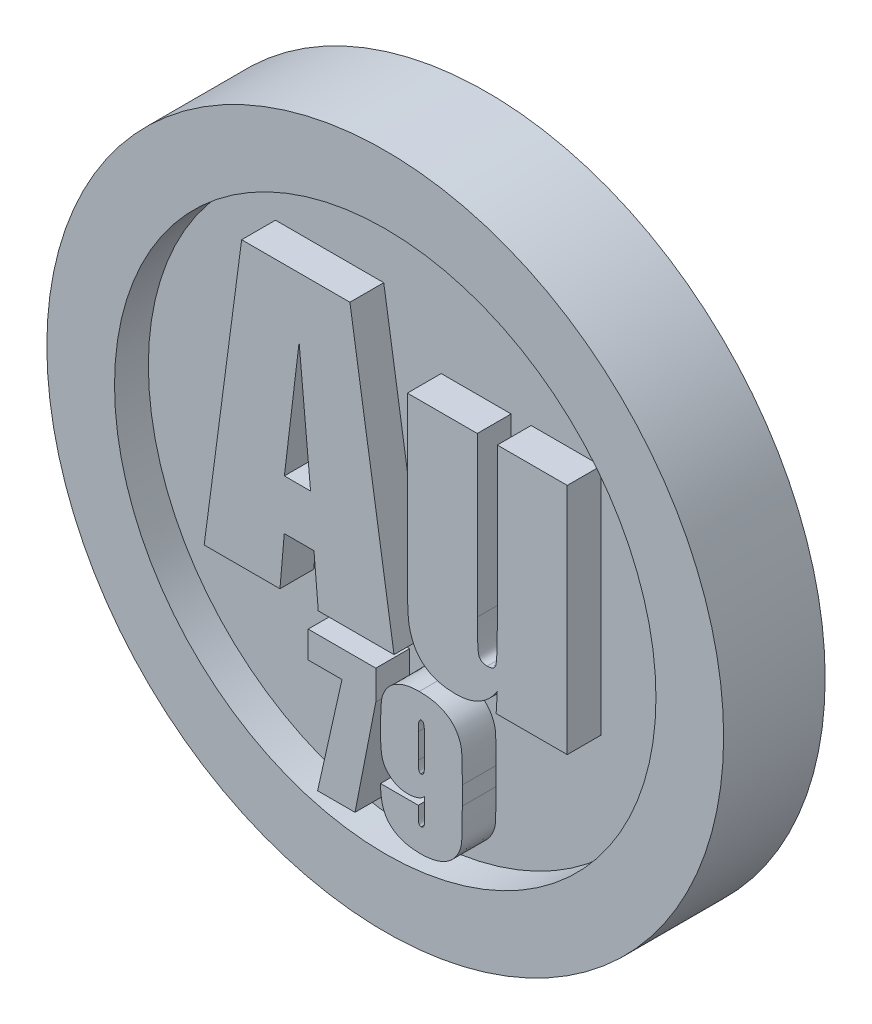
from build123d import *

# Parameters (mm, degrees)
SKETCH_1_R          = 10
EXTRUDE_1_DEPTH     = 3
SKETCH_2_R          = 8
CUT_EXTRUDE_1_DEPTH = 1
EXTRUDE_3_DEPTH     = 1


# Read off the part's stored shape, not the designer's step: 凸台-拉伸3
with BuildPart() as part:
    # 草图1 → 凸台-拉伸1 (new body)
    with BuildSketch(Plane.XY):
        Circle(SKETCH_1_R)
    extrude(amount=EXTRUDE_1_DEPTH)

    # 草图2 → 切除-拉伸1 (cut)
    with BuildSketch(Plane.XY.offset(3)):
        Circle(SKETCH_2_R)
    extrude(amount=-CUT_EXTRUDE_1_DEPTH, mode=Mode.SUBTRACT)

    # 凸台-拉伸3 outline → 凸台-拉伸3 (add)
    # profile 1 of 4: a face of its own
    with BuildSketch(Plane.XY.offset(2)):
        with BuildLine():
            add(Edge.make_bspline(
                [(3.012789225, -1.687269702), (3.045348533, -1.686038209), (3.104946538, -1.683784029), (3.185224789, -1.654478221), (3.243607919, -1.602430732), (3.270375839, -1.539755165), (3.279792433, -1.474668249), (3.290192494, -1.40305599), (3.294308978, -1.309431072), (3.301318612, -1.194689415), (3.305562089, -1.058271151), (3.308006769, -0.900357085), (3.31209312, -0.720432098), (3.311476185, -0.593281641), (3.311150326, -0.526122117)],
                knots=[0, 0, 0, 0, 0.073005663, 0.133632809, 0.188340706, 0.244096719, 0.282789643, 0.336304753, 0.406825489, 0.493468461, 0.595044245, 0.713887454, 0.848878385, 1, 1, 1, 1], degree=3))
            add(Edge.make_bspline(
                [(2.720579899, -0.578412206), (2.720248015, -0.642496334), (2.719621371, -0.763496405), (2.723758231, -0.934701432), (2.726078574, -1.084939222), (2.730686012, -1.21465864), (2.736556105, -1.323908084), (2.743982945, -1.41316638), (2.752466945, -1.482140019), (2.765425852, -1.544887938), (2.792375012, -1.604945294), (2.850110239, -1.653777043), (2.925532864, -1.683712524), (2.982224769, -1.686023681), (3.012789225, -1.687269702)],
                knots=[0, 0, 0, 0, 0.151003576, 0.285116516, 0.403527971, 0.505067069, 0.590973108, 0.661298637, 0.716141007, 0.754532757, 0.812341691, 0.867117496, 0.928358709, 1, 1, 1, 1], degree=3))
            Line((2.720579899, -0.578412206), (2.720579899, 4.120006168))
            Line((2.720579899, 4.120006168), (0.653583403, 4.120006168))
            Line((0.653583403, 4.120006168), (0.653583403, -0.509204734))
            add(Edge.make_bspline(
                [(2.076181438, -2.868410556), (2.00274373, -2.866446507), (1.861839797, -2.862678111), (1.660148026, -2.831285539), (1.476780852, -2.782125808), (1.314508408, -2.708628106), (1.17110435, -2.620110867), (1.051319717, -2.512866812), (0.944712481, -2.39813714), (0.865146733, -2.265544706), (0.800526791, -2.126853441), (0.750775868, -1.984209081), (0.71095018, -1.839600115), (0.689981716, -1.713980707), (0.680646363, -1.602219636), (0.672684274, -1.500244043), (0.666752702, -1.379726113), (0.662706349, -1.241269797), (0.657578995, -1.084423), (0.654813971, -0.909079417), (0.653227386, -0.715292332), (0.653461189, -0.579950525), (0.653583403, -0.509204734)],
                knots=[0, 0, 0, 0, 0.068617828, 0.131656096, 0.190380007, 0.245514932, 0.297638829, 0.347233545, 0.395433063, 0.443441578, 0.491041666, 0.538336761, 0.584491338, 0.631136012, 0.657127356, 0.689327811, 0.726760079, 0.769918433, 0.818825223, 0.873470533, 0.933860591, 1, 1, 1, 1], degree=3))
            add(Edge.make_bspline(
                [(3.311150326, -2.180949668), (3.275158258, -2.235856422), (3.205087995, -2.342750273), (3.077929268, -2.482109537), (2.940899141, -2.602094541), (2.790464577, -2.699416597), (2.628699285, -2.775941731), (2.454729594, -2.82955259), (2.269165897, -2.862577225), (2.141427659, -2.866438362), (2.076181438, -2.868410556)],
                knots=[0, 0, 0, 0, 0.132708338, 0.258359935, 0.38048677, 0.50051456, 0.619817915, 0.741587105, 0.86800769, 1, 1, 1, 1], degree=3))
            Line((3.311150326, -2.180949668), (3.277315562, -2.769982152))
            Line((3.277315562, -2.769982152), (5.378146822, -2.769982152))
            Line((5.378146822, -2.769982152), (5.378146822, 4.120006168))
            Line((5.378146822, 4.120006168), (3.311150326, 4.120006168))
            Line((3.311150326, 4.120006168), (3.311150326, -0.526122117))
        make_face()
    # profile 2 of 4: a face of its own
    with BuildSketch(Plane.XY.offset(2)):
        with BuildLine():
            add(Edge.make_bspline(
                [(1.04152451, -7.475964613), (1.007861085, -7.475565643), (0.941921185, -7.474784141), (0.845206802, -7.468098481), (0.753057726, -7.45742751), (0.665278959, -7.442100041), (0.582356891, -7.422648501), (0.503575954, -7.39942619), (0.429731467, -7.371284208), (0.360568357, -7.338238787), (0.295544864, -7.302309266), (0.236200134, -7.261361503), (0.181174013, -7.217608491), (0.130894695, -7.170225223), (0.084967137, -7.119222516), (0.043637875, -7.064827168), (0.006762772, -7.006979311), (-0.024461293, -6.944775763), (-0.051094046, -6.877973753), (-0.075647973, -6.806709798), (-0.094415608, -6.729459125), (-0.111715174, -6.647484333), (-0.123338683, -6.559789631), (-0.133267427, -6.467080164), (-0.137837881, -6.368874348), (-0.138904495, -6.301770493), (-0.13945098, -6.267389449)],
                knots=[0, 0, 0, 0, 0.051705343, 0.101280399, 0.148839266, 0.194144782, 0.238075556, 0.279609671, 0.32022114, 0.359314287, 0.397278482, 0.434206667, 0.469925946, 0.505179484, 0.540202765, 0.575235917, 0.610005546, 0.645431282, 0.681964099, 0.720420557, 0.76110008, 0.803985795, 0.849058707, 0.896906054, 0.947179228, 1, 1, 1, 1], degree=3))
            add(Edge.make_bspline(
                [(2.277699346, -5.638407423), (2.277848474, -5.692881179), (2.278134144, -5.797231036), (2.276189768, -5.946845911), (2.275031163, -6.08267085), (2.272973664, -6.204941857), (2.26970066, -6.313628504), (2.267560028, -6.408828394), (2.262621093, -6.490138344), (2.257791689, -6.580076661), (2.243820981, -6.683124035), (2.207666694, -6.801016071), (2.156735473, -6.916414854), (2.089289829, -7.027348227), (2.005979021, -7.130395105), (1.907098969, -7.222610945), (1.791373446, -7.299375293), (1.662600829, -7.363939552), (1.521659828, -7.414671229), (1.369973605, -7.449648175), (1.209004503, -7.472121162), (1.098254365, -7.474662735), (1.04152451, -7.475964613)],
                knots=[0, 0, 0, 0, 0.06268147, 0.120072542, 0.172170787, 0.218980413, 0.260782914, 0.297294467, 0.328540651, 0.354502855, 0.400952977, 0.44775597, 0.495898692, 0.54577851, 0.596683266, 0.647938237, 0.7007114, 0.755903444, 0.81335939, 0.872619976, 0.934751772, 1, 1, 1, 1], degree=3))
            Line((2.277699346, -5.638407423), (2.277699346, -5.097308567))
            add(Edge.make_bspline(
                [(1.005935458, -3.338918861), (1.039107827, -3.339455682), (1.104037401, -3.340506421), (1.199557013, -3.345259768), (1.290678887, -3.354729775), (1.37765445, -3.367943926), (1.460308923, -3.384023615), (1.538308782, -3.405825783), (1.612686563, -3.429092013), (1.704137909, -3.466707047), (1.808981122, -3.520823335), (1.921252547, -3.598243176), (2.016873703, -3.688351015), (2.094799758, -3.789823269), (2.157827849, -3.897038811), (2.206005864, -4.007363175), (2.240516416, -4.119598919), (2.255195905, -4.217106583), (2.261471251, -4.30195156), (2.265850304, -4.378230345), (2.26905784, -4.4671128), (2.273202511, -4.568768798), (2.274951265, -4.682825501), (2.276214859, -4.809690223), (2.278127881, -4.94913732), (2.27784639, -5.046466358), (2.277699346, -5.097308567)],
                knots=[0, 0, 0, 0, 0.038768086, 0.075882288, 0.11171829, 0.145767649, 0.178669348, 0.210032929, 0.240362509, 0.269677594, 0.32548065, 0.377907026, 0.428538595, 0.478338148, 0.52690745, 0.573529416, 0.618728806, 0.663705412, 0.688398203, 0.718152308, 0.752979089, 0.792329138, 0.837037118, 0.886266868, 0.940588709, 1, 1, 1, 1], degree=3))
            add(Edge.make_bspline(
                [(-0.13945098, -4.727618208), (-0.139269864, -4.693965404), (-0.138919342, -4.628835844), (-0.137417522, -4.534412453), (-0.13541563, -4.44627084), (-0.132066849, -4.364884835), (-0.126394413, -4.290138367), (-0.121913323, -4.222012992), (-0.115343643, -4.160238157), (-0.105032282, -4.086893285), (-0.085650289, -4.000372762), (-0.049204597, -3.901145395), (0.001229861, -3.805894425), (0.063294415, -3.714136724), (0.139491061, -3.629310274), (0.229223634, -3.553491368), (0.33252106, -3.489087858), (0.44783554, -3.434688736), (0.57389806, -3.39110037), (0.71019647, -3.361330014), (0.855012303, -3.341607931), (0.954783055, -3.339830268), (1.005935458, -3.338918861)],
                knots=[0, 0, 0, 0, 0.04801845, 0.092931944, 0.134743941, 0.173817707, 0.209136234, 0.241698214, 0.271225392, 0.297752974, 0.347362896, 0.397418232, 0.448099047, 0.500797632, 0.555104358, 0.610260334, 0.66786002, 0.728277797, 0.791858915, 0.857729882, 0.927058199, 1, 1, 1, 1], degree=3))
            Line((-0.13945098, -4.727618208), (-0.13945098, -5.039203992))
            add(Edge.make_bspline(
                [(0.658760621, -6.127938469), (0.614769859, -6.126257543), (0.528206529, -6.122949881), (0.402840652, -6.092801038), (0.285228386, -6.044335531), (0.178596668, -5.977222273), (0.085325146, -5.897155155), (0.008382102, -5.808275537), (-0.048685723, -5.710631628), (-0.087132967, -5.603553923), (-0.110372187, -5.4846789), (-0.127731896, -5.351239965), (-0.137395617, -5.200825514), (-0.138742684, -5.094900156), (-0.13945098, -5.039203992)],
                knots=[0, 0, 0, 0, 0.085392751, 0.168032572, 0.249043249, 0.331695127, 0.411777957, 0.487216224, 0.559127415, 0.630287954, 0.707260479, 0.794112382, 0.891743103, 1, 1, 1, 1], degree=3))
            add(Edge.make_bspline(
                [(1.162091508, -5.939564089), (1.159049233, -5.945181965), (1.149283024, -5.960671155), (1.128445888, -5.984185956), (1.097953331, -6.009829883), (1.048072432, -6.042665234), (0.975351098, -6.07706061), (0.878699366, -6.106531586), (0.772052112, -6.125221327), (0.697579366, -6.127007454), (0.658760621, -6.127938469)],
                knots=[0.203172937, 0.203172937, 0.203172937, 0.203172937, 0.230529217, 0.281345858, 0.337345134, 0.401018118, 0.537149324, 0.680734012, 0.833583348, 1, 1, 1, 1], degree=3))
            Line((1.162091508, -5.939564089), (1.162091503, -6.373430299))
            add(Edge.make_bspline(
                [(1.056050654, -6.778709711), (1.069035857, -6.777170312), (1.095116116, -6.774078491), (1.128996562, -6.747516299), (1.15145133, -6.705346801), (1.158088705, -6.657914716), (1.160300433, -6.605893365), (1.161633155, -6.545563311), (1.16225446, -6.465918008), (1.162149519, -6.406357469), (1.162091503, -6.373430299)],
                knots=[0, 0, 0, 0, 0.0841938, 0.169099863, 0.269108966, 0.389965376, 0.478799784, 0.610314704, 0.784568207, 1, 1, 1, 1], degree=3))
            add(Edge.make_bspline(
                [(0.976156863, -6.267389449), (0.976180163, -6.293536392), (0.976224392, -6.343167162), (0.975929657, -6.41362184), (0.976857173, -6.475598482), (0.977557676, -6.529101819), (0.978227096, -6.574137917), (0.979083022, -6.610925134), (0.979383846, -6.639299401), (0.982042628, -6.673388228), (0.987381045, -6.712115679), (1.007191115, -6.750322555), (1.031222407, -6.772928567), (1.048802145, -6.777021929), (1.056050654, -6.778709711)],
                knots=[0, 0, 0, 0, 0.144212104, 0.273735938, 0.388579266, 0.486065111, 0.568864309, 0.636977559, 0.689071269, 0.725223071, 0.825787888, 0.901665207, 0.959454429, 1, 1, 1, 1], degree=3))
            Line((0.976156863, -6.267389449), (-0.13945098, -6.267389449))
        make_face()
        with BuildLine():
            add(Edge.make_bspline(
                [(0.976156863, -5.11473994), (0.976359077, -5.133865993), (0.976740528, -5.16994474), (0.977878908, -5.220822777), (0.98087693, -5.265137495), (0.984503133, -5.303158822), (0.988438598, -5.335035357), (0.99402574, -5.36064872), (1.000856227, -5.379946127), (1.011275973, -5.396039827), (1.024195268, -5.408099059), (1.035313094, -5.419448673), (1.041229969, -5.42739668), (1.044890527, -5.429982847), (1.045882353, -5.430683567)],
                knots=[0, 0, 0, 0, 0.171150155, 0.322851923, 0.455279052, 0.568445369, 0.664643995, 0.742419327, 0.802765019, 0.846628929, 0.912513888, 0.960024208, 0.989168579, 1, 1, 1, 1], degree=3))
            Line((0.976156863, -5.11473994), (0.976156863, -4.3833486))
            add(Edge.make_bspline(
                [(1.048061275, -4.036173763), (1.047874259, -4.037171848), (1.047077013, -4.041426668), (1.038210213, -4.047578796), (1.029108453, -4.061964064), (1.014181805, -4.074767732), (1.002990082, -4.092637727), (0.996326007, -4.113833522), (0.989706588, -4.14144821), (0.985182347, -4.17652458), (0.980675845, -4.218386221), (0.977946807, -4.267350335), (0.976725498, -4.323058089), (0.976353242, -4.362527107), (0.976156863, -4.3833486)],
                knots=[0, 0, 0, 0, 0.008193739, 0.034929771, 0.08149308, 0.149001907, 0.193660327, 0.252746219, 0.330351734, 0.426749868, 0.542626835, 0.676011241, 0.829082917, 1, 1, 1, 1], degree=3))
            add(Edge.make_bspline(
                [(1.162091503, -4.407316737), (1.161779176, -4.387709618), (1.161185365, -4.350431576), (1.161424004, -4.297341864), (1.157620109, -4.25020407), (1.155608002, -4.208666361), (1.150551237, -4.173204353), (1.147138984, -4.142835647), (1.140401173, -4.118713266), (1.132112048, -4.094494314), (1.118887698, -4.071399505), (1.098869267, -4.050633147), (1.074481792, -4.038009569), (1.05691427, -4.036788906), (1.048061275, -4.036173763)],
                knots=[0, 0, 0, 0, 0.138938561, 0.264157001, 0.37585331, 0.473857868, 0.558528432, 0.629599007, 0.689922924, 0.735495863, 0.810806826, 0.876298101, 0.937661537, 1, 1, 1, 1], degree=3))
            Line((1.162091503, -4.407316737), (1.162091503, -5.11473994))
            add(Edge.make_bspline(
                [(1.045882353, -5.430683567), (1.054723391, -5.430028237), (1.072161156, -5.428735688), (1.096186093, -5.417047316), (1.116493518, -5.398573061), (1.134699536, -5.371741839), (1.14683152, -5.331148501), (1.156951861, -5.275249316), (1.160536766, -5.200953495), (1.161537193, -5.145477646), (1.162091503, -5.11473994)],
                knots=[0, 0, 0, 0, 0.071204154, 0.14044066, 0.211212287, 0.2916304, 0.399433651, 0.55082945, 0.751126429, 1, 1, 1, 1], degree=3))
        make_face(mode=Mode.SUBTRACT)
    # profile 3 of 4: a face of its own
    with BuildSketch(Plane.XY.offset(2)):
        Polygon((0.259869785, -2.769982152), (-1.044306576, 5.596432236), (-4.243229724, 5.596432236), (-5.350549276, -2.769982152), (-3.111303072, -2.769982152), (-2.983653735, -1.293556083), (-2.105487813, -1.293556083), (-1.979376419, -2.769982152), align=None)
        with BuildLine():
            add(Edge.make_bspline(
                [(-2.206992105, 0.182869985), (-2.218858703, 0.308974336), (-2.243265861, 0.568345122), (-2.279411042, 0.968329673), (-2.320900543, 1.390004217), (-2.358792947, 1.834294103), (-2.405543229, 2.300460571), (-2.448513159, 2.789261109), (-2.497069047, 3.299729457), (-2.529029962, 3.647335954), (-2.545339746, 3.824720954)],
                knots=[0, 0, 0, 0, 0.103890648, 0.213681756, 0.329412424, 0.451423629, 0.579413063, 0.713682438, 0.853890992, 1, 1, 1, 1], degree=3))
            Line((-2.206992105, 0.182869985), (-2.980577847, 0.182869985))
            add(Edge.make_bspline(
                [(-2.545339746, 3.824720954), (-2.568720322, 3.625789386), (-2.613922456, 3.241191023), (-2.682640027, 2.684704493), (-2.743481851, 2.168325186), (-2.800400729, 1.692589828), (-2.853365132, 1.258005529), (-2.898341589, 0.863518601), (-2.94253406, 0.510049146), (-2.968415494, 0.287467053), (-2.980577847, 0.182869985)],
                knots=[0, 0, 0, 0, 0.163832839, 0.316741291, 0.458625311, 0.589118589, 0.708637506, 0.816716194, 0.913870211, 1, 1, 1, 1], degree=3))
        make_face(mode=Mode.SUBTRACT)
    # profile 4 of 4: a face of its own
    with BuildSketch(Plane.XY.offset(2)):
        Polygon((-0.278901961, -4.251886998), (-0.278901961, -3.385402521), (-2.277699346, -3.385402521), (-2.277699346, -4.175624743), (-1.278300654, -4.175624743), (-1.998797386, -7.382997292), (-0.893357843, -7.382997292), align=None)
    extrude(amount=EXTRUDE_3_DEPTH)


solid = part.part
